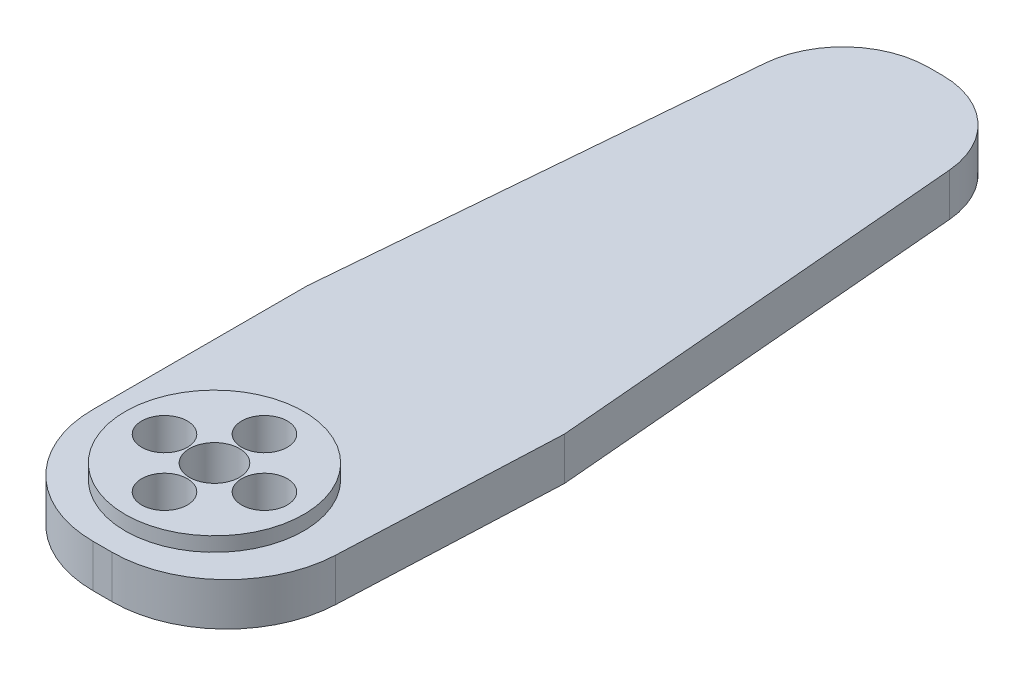
from build123d import *

# Parameters (mm, degrees)
BOSS_1_DEPTH  = 6
S_CYL2_R      = 12.5
BOSS_2_DEPTH  = 2
S_HOLE3_R     = 3.5
HOLE_3_DEPTH  = 8.2
S_HOLE4_R     = 1.7
HOLE_4_DEPTH  = 8.2
S_HOLE5_R     = 1.7
HOLE_5_DEPTH  = 8.2
S_HOLE6_R     = 1.7
HOLE_6_DEPTH  = 8.2
S_HOLE7_R     = 1.7
HOLE_7_DEPTH  = 8.2
S_HOLE8_R     = 3.2
HOLE_8_DEPTH  = 5.1
S_HOLE9_R     = 3.2
HOLE_9_DEPTH  = 5.1
S_HOLE10_R    = 3.2
HOLE_10_DEPTH = 5.1
S_HOLE11_R    = 3.2
HOLE_11_DEPTH = 5.1


with BuildPart() as part:
    # S_prism1 → Boss_1 (new body)
    with BuildSketch(Plane(origin=(0, 0, 0), x_dir=(1, 0, 0), z_dir=(0, 1, 0))):
        with BuildLine():
            Line((-1, -16), (1.6805, -16))
            ThreePointArc((1.6805, -16), (12.745771818, -11.556826983), (17.6654, -0.695))
            Line((17.6654, -0.695), (19, 30))
            Line((19, 30), (13.9407, 89.0248))
            ThreePointArc((13.9407, 89.0248), (10.099439666, 96.840163588), (1.9846, 100))
            Line((1.9846, 100), (0.0154, 100))
            ThreePointArc((0.0154, 100), (-8.099439666, 96.840163588), (-11.9407, 89.0248))
            Line((-11.9407, 89.0248), (-17, 30))
            Line((-17, 30), (-17, 0))
            ThreePointArc((-17, 0), (-12.3137, -11.3137), (-1, -16))
        make_face()
    extrude(amount=BOSS_1_DEPTH)

    # S_cyl2 → Boss_2 (add)
    with BuildSketch(Plane(origin=(0, 6, 0), x_dir=(1, 0, 0), z_dir=(0, 1, 0))):
        Circle(S_CYL2_R)
    extrude(amount=BOSS_2_DEPTH)

    # S_hole3 → Hole_3 (cut)
    with BuildSketch(Plane(origin=(0, -0.1, 0), x_dir=(1, 0, 0), z_dir=(0, 1, 0))):
        Circle(S_HOLE3_R)
    extrude(amount=HOLE_3_DEPTH, mode=Mode.SUBTRACT)

    # S_hole4 → Hole_4 (cut)
    with BuildSketch(Plane(origin=(0, -0.1, 0), x_dir=(1, 0, 0), z_dir=(0, 1, 0))):
        with Locations((7, 0)):
            Circle(S_HOLE4_R)
    extrude(amount=HOLE_4_DEPTH, mode=Mode.SUBTRACT)

    # S_hole5 → Hole_5 (cut)
    with BuildSketch(Plane(origin=(0, -0.1, 0), x_dir=(1, 0, 0), z_dir=(0, 1, 0))):
        with Locations((0, -7)):
            Circle(S_HOLE5_R)
    extrude(amount=HOLE_5_DEPTH, mode=Mode.SUBTRACT)

    # S_hole6 → Hole_6 (cut)
    with BuildSketch(Plane(origin=(0, -0.1, 0), x_dir=(1, 0, 0), z_dir=(0, 1, 0))):
        with Locations((-7, 0)):
            Circle(S_HOLE6_R)
    extrude(amount=HOLE_6_DEPTH, mode=Mode.SUBTRACT)

    # S_hole7 → Hole_7 (cut)
    with BuildSketch(Plane(origin=(0, -0.1, 0), x_dir=(1, 0, 0), z_dir=(0, 1, 0))):
        with Locations((0, 7)):
            Circle(S_HOLE7_R)
    extrude(amount=HOLE_7_DEPTH, mode=Mode.SUBTRACT)

    # S_hole8 → Hole_8 (cut)
    with BuildSketch(Plane(origin=(0, 3, 0), x_dir=(1, 0, 0), z_dir=(0, 1, 0))):
        with Locations((7, 0)):
            Circle(S_HOLE8_R)
    extrude(amount=HOLE_8_DEPTH, mode=Mode.SUBTRACT)

    # S_hole9 → Hole_9 (cut)
    with BuildSketch(Plane(origin=(0, 3, 0), x_dir=(1, 0, 0), z_dir=(0, 1, 0))):
        with Locations((0, -7)):
            Circle(S_HOLE9_R)
    extrude(amount=HOLE_9_DEPTH, mode=Mode.SUBTRACT)

    # S_hole10 → Hole_10 (cut)
    with BuildSketch(Plane(origin=(0, 3, 0), x_dir=(1, 0, 0), z_dir=(0, 1, 0))):
        with Locations((-7, 0)):
            Circle(S_HOLE10_R)
    extrude(amount=HOLE_10_DEPTH, mode=Mode.SUBTRACT)

    # S_hole11 → Hole_11 (cut)
    with BuildSketch(Plane(origin=(0, 3, 0), x_dir=(1, 0, 0), z_dir=(0, 1, 0))):
        with Locations((0, 7)):
            Circle(S_HOLE11_R)
    extrude(amount=HOLE_11_DEPTH, mode=Mode.SUBTRACT)


solid = part.part
